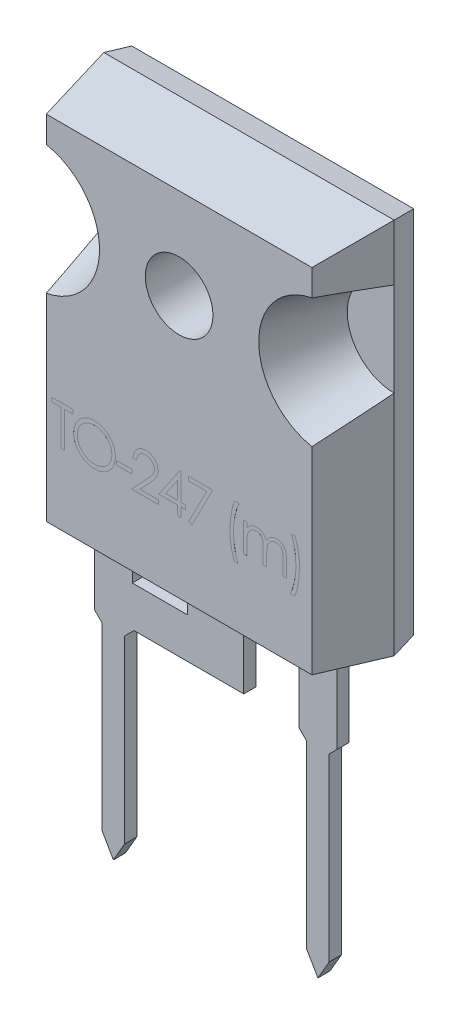
from build123d import *

# Parameters (mm, degrees)
SKETCH1_W                     = 15.5
SKETCH1_H                     = 20.15
BOSS_EXTRUDE1_DEPTH           = 1.27
BOSS_EXTRUDE1_TAPER           = 10
BOSS_EXTRUDE1_OTHER_WAY_DEPTH = 3.73
BOSS_EXTRUDE1_OTHER_WAY_TAPER = 10
SKETCH2_R                     = 2.5
CUT_EXTRUDE1_DEPTH            = 3.73
CUT_EXTRUDE1_DRAFT            = -15
CUT_EXTRUDE1_PROFILE_2_DEPTH  = 3.73
CUT_EXTRUDE1_PROFILE_2_DRAFT  = -15
CUT_EXTRUDE2_DEPTH            = 14.246925249
CUT_EXTRUDE2_DEPTH_BACK       = 14.246925249
SKETCH4_R                     = 1.805
SKETCH5_W                     = 2.02
SKETCH5_H                     = 0.65
SKETCH5_W_2                   = 3
BOSS_EXTRUDE2_DEPTH           = 14.07
SKETCH6_W                     = 7.97
SKETCH6_H                     = 2.154431013
BOSS_EXTRUDE3_DEPTH           = 0.65
SKETCH7_R                     = 1.805
BOSS_EXTRUDE4_DEPTH           = 0.0001
BOSS_EXTRUDE5_DEPTH           = 0.65
CHAMFER1_SIZE                 = 0.5
SKETCH9_W                     = 0.814102564
SKETCH9_H                     = 0.217094017
CUT_EXTRUDE3_DEPTH            = 0.0001


with BuildPart() as part:
    # Sketch1 → Boss-Extrude1 (new body)
    with BuildSketch(Plane.XY):
        Rectangle(SKETCH1_W, SKETCH1_H)
    extrude(amount=-BOSS_EXTRUDE1_DEPTH, taper=BOSS_EXTRUDE1_TAPER)

    # Sketch1 → Boss-Extrude1 other way (add)
    with BuildSketch(Plane.XY):
        Rectangle(SKETCH1_W, SKETCH1_H)
    extrude(amount=BOSS_EXTRUDE1_OTHER_WAY_DEPTH, taper=BOSS_EXTRUDE1_OTHER_WAY_TAPER)


with BuildPart() as cut_extrude1_tool:
    # Sketch2 → Cut-Extrude1 (with draft: the straight prism first)
    with BuildSketch(Plane.XY):
        with Locations((-7.75, 4.575)):
            Circle(SKETCH2_R)
    extrude(amount=CUT_EXTRUDE1_DEPTH)
    # Cut-Extrude1: the draft: its side faces are tilted about the plane it starts from
    cut_extrude1_sides = [cut_extrude1_tool.faces().sort_by_distance(p)[0] for p in [
        (-10.25, 4.575, 1.865),
    ]]
    draft(cut_extrude1_sides, Plane.XY, CUT_EXTRUDE1_DRAFT)


with BuildPart() as part_1:
    add(part.part)

    # Cut-Extrude1: cut by cut_extrude1_tool
    add(cut_extrude1_tool.part, mode=Mode.SUBTRACT)


with BuildPart() as cut_extrude1_profile_2_tool:
    # Sketch2 → Cut-Extrude1 profile 2 (with draft: the straight prism first)
    with BuildSketch(Plane.XY):
        with Locations((7.75, 4.575)):
            Circle(SKETCH2_R)
    extrude(amount=CUT_EXTRUDE1_PROFILE_2_DEPTH)
    # Cut-Extrude1 profile 2: the draft: its side faces are tilted about the plane it starts from
    cut_extrude1_profile_2_sides = [cut_extrude1_profile_2_tool.faces().sort_by_distance(p)[0] for p in [
        (5.25, 4.575, 1.865),
    ]]
    draft(cut_extrude1_profile_2_sides, Plane.XY, CUT_EXTRUDE1_PROFILE_2_DRAFT)


with BuildPart() as part_2:
    add(part_1.part)

    # Cut-Extrude1 profile 2: cut by cut_extrude1_profile_2_tool
    add(cut_extrude1_profile_2_tool.part, mode=Mode.SUBTRACT)

    # Sketch4 → Cut-Extrude2 (cut, two sides: drawn at the far end of the back side and taken through both)
    with BuildSketch(Plane.XY.offset(-CUT_EXTRUDE2_DEPTH_BACK)):
        with Locations(Location((0, 4.565, 0), (0, 0, 180))):
            Circle(SKETCH4_R)
    extrude(amount=CUT_EXTRUDE2_DEPTH + CUT_EXTRUDE2_DEPTH_BACK, mode=Mode.SUBTRACT)

    # Sketch5 → Boss-Extrude2 (add)
    with BuildSketch(Plane(origin=(0, 0, 0), x_dir=(1, 0, 0), z_dir=(0, 1, 0))):
        with Locations((-5.46, -1.455)):
            Rectangle(SKETCH5_W, SKETCH5_H)
        with Locations((5.46, -1.455)):
            Rectangle(SKETCH5_W, SKETCH5_H)
        with Locations((0, -1.455)):
            Rectangle(SKETCH5_W_2, SKETCH5_H)
    extrude(amount=-BOSS_EXTRUDE2_DEPTH)

    # Sketch6 → Boss-Extrude3 (add)
    with BuildSketch(Plane.XY.offset(1.78)):
        with Locations((-2.485, -12.992784494)):
            Rectangle(SKETCH6_W, SKETCH6_H)
    extrude(amount=-BOSS_EXTRUDE3_DEPTH)

    # Sketch7 → Boss-Extrude4 (add)
    with BuildSketch(Plane(origin=(0, 0, -1.27), x_dir=(-1, 0, 0), z_dir=(0, 0, -1))):
        with BuildLine():
            Line((-5.9, 9.225), (5.9, 9.225))
            ThreePointArc((5.9, 9.225), (6.607106781, 8.932106781), (6.9, 8.225))
            Line((6.9, 8.225), (6.9, -3.855))
            Line((6.9, -3.855), (-6.9, -3.855))
            Line((-6.9, -3.855), (-6.9, 8.225))
            ThreePointArc((-6.9, 8.225), (-6.607106781, 8.932106781), (-5.9, 9.225))
        make_face()
        with Locations((0, 4.565)):
            Circle(SKETCH7_R, mode=Mode.SUBTRACT)
    extrude(amount=BOSS_EXTRUDE4_DEPTH)

    # Sketch8 → Boss-Extrude5 (add)
    with BuildSketch(Plane.XY.offset(1.78)):
        Polygon((-6.06, -14.07), (-6.06, -24.185769515), (-5.46, -25.225), (-4.86, -24.185769515), (-4.86, -14.07), align=None)
        Polygon((6.06, -14.07), (6.06, -24.185769515), (5.46, -25.225), (4.86, -24.185769515), (4.86, -14.07), align=None)
    extrude(amount=-BOSS_EXTRUDE5_DEPTH)

    # Chamfer1
    # the kernel refuses this chamfer: 0.5 mm, written as the material it adds along each edge
    with BuildSketch(Plane(origin=(4.86, -14.07, 1.78), x_dir=(-0.9996219169112968, 0.027495876610585647, 0), z_dir=(0, 0, -1))) as chamfer1_piece_1_section:
        Polygon((CHAMFER1_SIZE * 0.999621916911, -CHAMFER1_SIZE * 0.0274958766106), (-CHAMFER1_SIZE * 0.0274958766106, -CHAMFER1_SIZE * 0.999621916911), (0, 0), align=None)
    chamfer1_piece_1 = extrude(amount=0.65, mode=Mode.PRIVATE)
    chamfer1_piece_1 = split(chamfer1_piece_1, bisect_by=Plane(origin=(4.45, -14.241727984, 1.455), z_dir=(1, 0, 0)), keep=Keep.TOP, mode=Mode.PRIVATE)
    add(chamfer1_piece_1)
    with BuildSketch(Plane(origin=(6.06, -14.07, 1.78), x_dir=(0.9996219169112968, 0.027495876610585647, 0), z_dir=(0, 0, -1))) as chamfer1_piece_2_section:
        Polygon((CHAMFER1_SIZE * 0.999621916911, CHAMFER1_SIZE * 0.0274958766106), (-CHAMFER1_SIZE * 0.0274958766106, CHAMFER1_SIZE * 0.999621916911), (0, 0), align=None)
    chamfer1_piece_2 = extrude(amount=0.65, mode=Mode.PRIVATE)
    chamfer1_piece_2 = split(chamfer1_piece_2, bisect_by=Plane(origin=(6.47, -14.241727984, 1.455), z_dir=(-1, 0, 0)), keep=Keep.TOP, mode=Mode.PRIVATE)
    add(chamfer1_piece_2)
    with BuildSketch(Plane(origin=(-4.86, -14.07, 1.78), x_dir=(0.9996219169112968, 0.027495876610585647, 0), z_dir=(0, 0, -1))) as chamfer1_piece_3:
        Polygon((CHAMFER1_SIZE * 0.999621916911, CHAMFER1_SIZE * 0.0274958766106), (-CHAMFER1_SIZE * 0.0274958766106, CHAMFER1_SIZE * 0.999621916911), (0, 0), align=None)
    extrude(amount=0.65)
    with BuildSketch(Plane(origin=(-6.06, -14.07, 1.78), x_dir=(-0.9996219169112968, 0.027495876610585647, 0), z_dir=(0, 0, -1))) as chamfer1_piece_4_section:
        Polygon((CHAMFER1_SIZE * 0.999621916911, -CHAMFER1_SIZE * 0.0274958766106), (-CHAMFER1_SIZE * 0.0274958766106, -CHAMFER1_SIZE * 0.999621916911), (0, 0), align=None)
    chamfer1_piece_4 = extrude(amount=0.65, mode=Mode.PRIVATE)
    chamfer1_piece_4 = split(chamfer1_piece_4, bisect_by=Plane(origin=(-6.47, -14.241727984, 1.455), z_dir=(1, 0, 0)), keep=Keep.TOP, mode=Mode.PRIVATE)
    add(chamfer1_piece_4)

    # Sketch9 → Cut-Extrude3 (cut)
    # profile 1 of 9: a face of its own
    with BuildSketch(Plane.XY.offset(3.73)):
        Polygon((-6.778760684, -3.741015158), (-6.778760684, -3.523921141), (-5.666153846, -3.523921141), (-5.666153846, -3.741015158), (-6.127478632, -3.741015158), (-6.127478632, -5.640587807), (-6.317435897, -5.640587807), (-6.317435897, -3.741015158), align=None)
    # profile 2 of 9: a face of its own
    with BuildSketch(Plane.XY.offset(3.73)):
        with BuildLine():
            add(Edge.make_bspline(
                [(-4.529123932, -3.469647636), (-4.489930458, -3.47064034), (-4.412951242, -3.472590093), (-4.299815471, -3.487515075), (-4.191807961, -3.51333562), (-4.088048877, -3.547724186), (-3.989779315, -3.593598029), (-3.896259604, -3.649045714), (-3.807712256, -3.714648143), (-3.725330754, -3.7898982), (-3.649942979, -3.871772955), (-3.583524467, -3.959147691), (-3.527860794, -4.05149411), (-3.48214939, -4.148534707), (-3.44628785, -4.250050021), (-3.421541571, -4.356581251), (-3.405734213, -4.467438154), (-3.403886195, -4.543049639), (-3.402948718, -4.58140645)],
                knots=[0, 0, 0, 0, 1.065120563, 2.091984664, 3.0946048, 4.079830382, 5.057816894, 6.036188127, 7.030412546, 8.04752943, 9.064399622, 10.05169764, 11.02544977, 11.989514704, 12.962713494, 13.945757189, 14.957906945, 16, 16, 16, 16], degree=3))
            add(Edge.make_bspline(
                [(-3.402948718, -4.58140645), (-3.403886058, -4.619480716), (-3.405733664, -4.694529503), (-3.421559544, -4.804682919), (-3.446379577, -4.910571102), (-3.481816367, -5.012017283), (-3.52730987, -5.109128476), (-3.583344188, -5.201649158), (-3.649348635, -5.289609659), (-3.724464206, -5.372046366), (-3.806349599, -5.447640075), (-3.894179331, -5.513510062), (-3.985978149, -5.570190842), (-4.082927353, -5.615417159), (-4.183741185, -5.651564939), (-4.289321923, -5.676210577), (-4.399174839, -5.69210798), (-4.474087303, -5.693933463), (-4.512163462, -5.694861311)],
                knots=[0, 0, 0, 0, 1.043624062, 2.057103931, 3.04512605, 4.022047818, 4.998200453, 5.980619268, 6.982898556, 8.009068085, 9.034988726, 10.034168286, 11.015286542, 11.987931943, 12.962482838, 13.94673481, 14.956375938, 16, 16, 16, 16], degree=3))
            add(Edge.make_bspline(
                [(-4.512163462, -5.694861311), (-4.550520073, -5.693924301), (-4.626131166, -5.692077205), (-4.737127373, -5.676243689), (-4.843733437, -5.651483948), (-4.945644497, -5.61609967), (-5.042917383, -5.570369249), (-5.135742338, -5.514607553), (-5.223746775, -5.448442282), (-5.306201069, -5.373351068), (-5.381644632, -5.291604463), (-5.447418159, -5.204014223), (-5.503192394, -5.11229878), (-5.548769267, -5.016203611), (-5.584852059, -4.916193262), (-5.609468782, -4.811600611), (-5.625395763, -4.703021958), (-5.627231122, -4.62909411), (-5.628162393, -4.591582732)],
                knots=[0, 0, 0, 0, 1.053102029, 2.075944431, 3.073151272, 4.055350789, 5.033113405, 6.020478099, 7.024410459, 8.052272461, 9.079885166, 10.07527673, 11.055994387, 12.023226415, 12.992069828, 13.970394897, 14.97016774, 16, 16, 16, 16], degree=3))
            add(Edge.make_bspline(
                [(-5.628162393, -4.591582732), (-5.627839066, -4.56640488), (-5.627196491, -4.516366805), (-5.619460562, -4.442061766), (-5.608235152, -4.368951702), (-5.592147329, -4.297244509), (-5.571106654, -4.227115723), (-5.546279952, -4.158081691), (-5.515957284, -4.09084201), (-5.481678987, -4.025078149), (-5.443420655, -3.961815273), (-5.401162464, -3.902016668), (-5.356388694, -3.845180541), (-5.307304165, -3.792779734), (-5.255526601, -3.743289856), (-5.200216058, -3.697471451), (-5.141710034, -3.654911362), (-5.079756785, -3.616557156), (-5.015882876, -3.581868536), (-4.950038348, -3.552101036), (-4.883117469, -3.526552227), (-4.814806801, -3.505844681), (-4.745287744, -3.489496735), (-4.67440857, -3.478364669), (-4.602225745, -3.47060901), (-4.553596043, -3.469969473), (-4.529123932, -3.469647636)],
                knots=[0, 0, 0, 0, 1.037015668, 2.060948919, 3.074880161, 4.083647147, 5.086022904, 6.090072063, 7.104153813, 8.122640571, 9.144368836, 10.147691507, 11.138137339, 12.123020368, 13.103399296, 14.087645067, 15.080126199, 16.082011238, 17.087798457, 18.072939717, 19.057185487, 20.037253025, 21.01195951, 21.997135196, 22.992090687, 24, 24, 24, 24], degree=3))
        make_face()
        with BuildLine():
            add(Edge.make_bspline(
                [(-4.519795673, -3.686741653), (-4.539882618, -3.686986516), (-4.579864476, -3.687473899), (-4.639303219, -3.693893879), (-4.697960246, -3.70304386), (-4.755847669, -3.716095541), (-4.812723283, -3.733877992), (-4.869117234, -3.754343685), (-4.924515271, -3.77927263), (-4.978734509, -3.807438027), (-5.031297436, -3.838612851), (-5.080895593, -3.873067205), (-5.127657383, -3.909993093), (-5.171468311, -3.94947669), (-5.212199734, -3.991719068), (-5.250653339, -4.036079827), (-5.2852878, -4.083826923), (-5.317029078, -4.133665597), (-5.345433438, -4.185530935), (-5.370691534, -4.238876899), (-5.391352625, -4.294138643), (-5.408202728, -4.350716633), (-5.422172614, -4.408521264), (-5.431022654, -4.467991039), (-5.437513176, -4.528827131), (-5.437972702, -4.569939966), (-5.438205128, -4.590734709)],
                knots=[0, 0, 0, 0, 1.008559885, 2.007477868, 2.99961109, 3.989939068, 4.984837346, 5.991145699, 7.001802488, 8.033829008, 9.059044045, 10.069351652, 11.065060232, 12.050310815, 13.029377138, 14.011219647, 14.996725999, 15.989392538, 16.977580475, 17.965360261, 18.951710183, 19.937753436, 20.929683414, 21.935841486, 22.955955122, 24, 24, 24, 24], degree=3))
            add(Edge.make_bspline(
                [(-5.438205128, -4.590734709), (-5.43743414, -4.621312814), (-5.435917368, -4.681469406), (-5.422638267, -4.769624426), (-5.402184025, -4.854344485), (-5.372032189, -4.935166021), (-5.334324912, -5.012783754), (-5.287741984, -5.086509131), (-5.232551965, -5.156362079), (-5.169860213, -5.221854932), (-5.101326957, -5.281633109), (-5.028554307, -5.334104313), (-4.952321887, -5.378500036), (-4.872430902, -5.414667865), (-4.789307867, -5.443327374), (-4.702417157, -5.462969212), (-4.612337594, -5.475896273), (-4.550935721, -5.477137702), (-4.519795673, -5.477767294)],
                knots=[0, 0, 0, 0, 1.032063989, 2.030389145, 3.003944642, 3.970395727, 4.937377036, 5.913328081, 6.909231446, 7.93887556, 8.970685674, 9.976071282, 10.964166581, 11.944589148, 12.933237628, 13.927779006, 14.949070134, 16, 16, 16, 16], degree=3))
            add(Edge.make_bspline(
                [(-4.519795673, -5.477767294), (-4.498865165, -5.477479727), (-4.457353681, -5.476909396), (-4.395610198, -5.471164958), (-4.334979061, -5.461953304), (-4.275545311, -5.448690479), (-4.217376401, -5.432091454), (-4.160229544, -5.412371542), (-4.104713435, -5.3877691), (-4.050127724, -5.360586291), (-3.997878568, -5.329598196), (-3.948000508, -5.296313219), (-3.901750749, -5.25944172), (-3.857972596, -5.220544757), (-3.817073946, -5.178838049), (-3.77933137, -5.13437582), (-3.744871956, -5.086877423), (-3.713142732, -5.037114344), (-3.684837902, -4.985107086), (-3.660176256, -4.93156771), (-3.639253843, -4.876628048), (-3.622363747, -4.82020886), (-3.609128254, -4.762417299), (-3.600008493, -4.703175985), (-3.593629199, -4.64260343), (-3.593148367, -4.601634527), (-3.592905983, -4.580982439)],
                knots=[0, 0, 0, 0, 1.047197238, 2.076906641, 3.100256066, 4.114471768, 5.12198147, 6.126382909, 7.136867548, 8.15857795, 9.17633901, 10.174870724, 11.156907918, 12.133735059, 13.104061851, 14.077631395, 15.04955518, 16.038496417, 17.029181396, 18.010275684, 18.986308667, 19.968651475, 20.955262928, 21.950658345, 22.966943676, 24, 24, 24, 24], degree=3))
            add(Edge.make_bspline(
                [(-3.592905983, -4.580982439), (-3.593148561, -4.560471634), (-3.593629759, -4.519784674), (-3.600005446, -4.45963456), (-3.609137889, -4.400819522), (-3.622299146, -4.343570461), (-3.63926281, -4.287872781), (-3.66017991, -4.233778796), (-3.684845305, -4.181086982), (-3.713153136, -4.129927574), (-3.744973182, -4.080836185), (-3.77974351, -4.033905202), (-3.818064459, -3.990015973), (-3.85884115, -3.948084991), (-3.903092114, -3.909006553), (-3.950616901, -3.872767696), (-4.000838554, -3.838493858), (-4.054013596, -3.807575066), (-4.108892083, -3.779021697), (-4.165203857, -3.754558471), (-4.222310979, -3.733771523), (-4.280068228, -3.716041739), (-4.338961744, -3.703094978), (-4.398593583, -3.693885634), (-4.458881244, -3.687476134), (-4.499426429, -3.686987257), (-4.519795673, -3.686741653)],
                knots=[0, 0, 0, 0, 1.02996197, 2.043119294, 3.035359645, 4.018872909, 4.991431989, 5.957985074, 6.929999688, 7.912076566, 8.892894881, 9.867085534, 10.843653904, 11.817741046, 12.803660682, 13.806313499, 14.818574707, 15.856120519, 16.894564902, 17.924820532, 18.937903209, 19.946497019, 20.957711757, 21.963978472, 22.977135795, 24, 24, 24, 24], degree=3))
        make_face(mode=Mode.SUBTRACT)
    # profile 3 of 9: a face of its own
    with BuildSketch(Plane.XY.offset(3.73)):
        with Locations((-2.930769231, -4.826485244)):
            Rectangle(SKETCH9_W, SKETCH9_H)
    # profile 4 of 9: a face of its own
    with BuildSketch(Plane.XY.offset(3.73)):
        with BuildLine():
            Line((-2.268632479, -4.175203192), (-2.458589744, -4.175203192))
            add(Edge.make_bspline(
                [(-2.458589744, -4.175203192), (-2.457351703, -4.150002226), (-2.454920226, -4.100508201), (-2.443533593, -4.028345648), (-2.427240777, -3.959369651), (-2.404204517, -3.894134036), (-2.375595482, -3.832061995), (-2.341287323, -3.773400081), (-2.300651042, -3.718372077), (-2.254564112, -3.667488109), (-2.204508792, -3.620808007), (-2.150499962, -3.580497455), (-2.093746065, -3.546438673), (-2.034419286, -3.517965732), (-1.971850278, -3.496593539), (-1.906606835, -3.480735691), (-1.83840231, -3.471194758), (-1.791932392, -3.470169211), (-1.768298611, -3.469647636)],
                knots=[0, 0, 0, 0, 1.10065271, 2.161652631, 3.183658789, 4.190468796, 5.17591951, 6.163126047, 7.15150782, 8.156236427, 9.156009102, 10.134482811, 11.092018607, 12.041330605, 13.001268258, 13.972401359, 14.968799086, 16, 16, 16, 16], degree=3))
            add(Edge.make_bspline(
                [(-1.768298611, -3.469647636), (-1.745089014, -3.470190988), (-1.699482985, -3.471258656), (-1.632921671, -3.480427469), (-1.569556355, -3.494787898), (-1.509510896, -3.514935793), (-1.453264371, -3.542019709), (-1.400394244, -3.574554411), (-1.350271087, -3.612182594), (-1.305151747, -3.65648371), (-1.26372067, -3.703777533), (-1.227977878, -3.754267837), (-1.197368965, -3.806416024), (-1.171855463, -3.860619746), (-1.153073893, -3.917389368), (-1.138814691, -3.97589839), (-1.130754779, -4.036752443), (-1.129517785, -4.077940693), (-1.128888889, -4.098881076)],
                knots=[0, 0, 0, 0, 1.111607364, 2.184268762, 3.212621178, 4.221274766, 5.211760367, 6.196651075, 7.1921475, 8.207485113, 9.220403448, 10.201281604, 11.166441695, 12.114753415, 13.065576456, 14.026450734, 14.996634279, 16, 16, 16, 16], degree=3))
            add(Edge.make_bspline(
                [(-1.128888889, -4.098881076), (-1.12991291, -4.12836191), (-1.131942981, -4.186806229), (-1.149308342, -4.272691408), (-1.176429804, -4.355902667), (-1.209085348, -4.422872368), (-1.242028207, -4.476837386), (-1.271714462, -4.52126846), (-1.30646699, -4.569108434), (-1.346791606, -4.620197109), (-1.391854152, -4.674934656), (-1.442062794, -4.733288009), (-1.497775567, -4.79465427), (-1.536878565, -4.836567657), (-1.557140759, -4.858286124)],
                knots=[0, 0, 0, 0, 1.184426356, 2.348067706, 3.509069118, 4.696110526, 5.333549288, 6.050745305, 6.844228056, 7.710549037, 8.667450064, 9.695053472, 10.805634456, 12, 12, 12, 12], degree=3))
            Line((-1.557140759, -4.858286124), (-2.086731437, -5.42349379))
            Line((-2.086731437, -5.42349379), (-1.101752137, -5.42349379))
            Line((-1.101752137, -5.42349379), (-1.101752137, -5.640587807))
            Line((-1.101752137, -5.640587807), (-2.54, -5.640587807))
            Line((-2.54, -5.640587807), (-1.719113248, -4.764579527))
            add(Edge.make_bspline(
                [(-1.719113248, -4.764579527), (-1.699127145, -4.743716266), (-1.660737931, -4.70364221), (-1.606440849, -4.645135753), (-1.557673461, -4.59085865), (-1.514120085, -4.540913452), (-1.476725537, -4.494569599), (-1.443540901, -4.45332804), (-1.416952187, -4.415376539), (-1.388095733, -4.371385787), (-1.360147278, -4.317675481), (-1.336130758, -4.25203844), (-1.32148654, -4.184470054), (-1.319729806, -4.138809298), (-1.318846154, -4.115841546)],
                knots=[0, 0, 0, 0, 1.329631726, 2.553950428, 3.673215718, 4.687767853, 5.603093632, 6.413772471, 7.123043292, 7.734684054, 8.834405432, 9.900288307, 10.943827018, 12, 12, 12, 12], degree=3))
            add(Edge.make_bspline(
                [(-1.318846154, -4.115841546), (-1.319230627, -4.101398987), (-1.319988348, -4.072935474), (-1.326675623, -4.03120342), (-1.3367815, -3.990947556), (-1.35126268, -3.952044058), (-1.370377232, -3.914884068), (-1.393644467, -3.879422354), (-1.420489886, -3.845139028), (-1.451545178, -3.812993938), (-1.485660716, -3.783553399), (-1.521701048, -3.757473595), (-1.559831349, -3.735678514), (-1.599890851, -3.717811732), (-1.641767873, -3.703796145), (-1.68554341, -3.694084528), (-1.731096505, -3.687987025), (-1.762201524, -3.687162026), (-1.778050881, -3.686741653)],
                knots=[0, 0, 0, 0, 0.991446411, 1.95395049, 2.89581595, 3.838931463, 4.798493298, 5.75982156, 6.748411868, 7.785213223, 8.824556874, 9.840280684, 10.836137867, 11.835679398, 12.848801643, 13.863922112, 14.911575587, 16, 16, 16, 16], degree=3))
            add(Edge.make_bspline(
                [(-1.778050881, -3.686741653), (-1.794603718, -3.687174078), (-1.827110757, -3.688023287), (-1.874837982, -3.69396366), (-1.920367952, -3.704211859), (-1.963815198, -3.718228229), (-2.005253233, -3.736043637), (-2.044480536, -3.758233406), (-2.081409045, -3.784711995), (-2.116108181, -3.814732713), (-2.148078301, -3.848156452), (-2.176167603, -3.885415811), (-2.200711268, -3.925830486), (-2.222125424, -3.969291428), (-2.23951577, -4.016193), (-2.252804294, -4.066368707), (-2.263319197, -4.119600686), (-2.266831969, -4.156361189), (-2.268632479, -4.175203192)],
                knots=[0, 0, 0, 0, 1.031018746, 2.02475058, 2.990194455, 3.934040569, 4.864654155, 5.795059489, 6.735614925, 7.690564532, 8.649604399, 9.611025574, 10.590972636, 11.591080095, 12.624614302, 13.701020113, 14.821632451, 16, 16, 16, 16], degree=3))
        make_face()
    # profile 5 of 9: a face of its own
    with BuildSketch(Plane.XY.offset(3.73)):
        Polygon((0.064534589, -3.469647636), (0.103119658, -3.469647636), (0.103119658, -4.935032252), (0.347350427, -4.935032252), (0.347350427, -5.152126269), (0.103119658, -5.152126269), (0.103119658, -5.640587807), (-0.086837607, -5.640587807), (-0.086837607, -5.152126269), (-1.090897436, -5.152126269), align=None)
        Polygon((-0.086837607, -4.935032252), (-0.086837607, -4.015774773), (-0.717767094, -4.935032252), align=None, mode=Mode.SUBTRACT)
    # profile 6 of 9: a face of its own
    with BuildSketch(Plane.XY.offset(3.73)):
        Polygon((0.493888889, -3.523921141), (1.796452991, -3.523921141), (0.683846154, -5.694861311), (0.519753606, -5.604546808), (1.475052083, -3.741015158), (0.493888889, -3.741015158), align=None)
    # profile 7 of 9: a face of its own
    with BuildSketch(Plane.XY.offset(3.73)):
        with BuildLine():
            Line((2.957905983, -3.442510884), (3.202136752, -3.442510884))
            add(Edge.make_bspline(
                [(3.202136752, -3.442510884), (3.190919219, -3.466736448), (3.16814216, -3.515926149), (3.137189507, -3.592194004), (3.107177227, -3.671072361), (3.079993058, -3.753356488), (3.052942358, -3.838234059), (3.028663655, -3.926458343), (3.005599402, -4.017464274), (2.977400292, -4.142960817), (2.947598382, -4.30328488), (2.922254359, -4.499031695), (2.906535963, -4.697750179), (2.904603558, -4.831403379), (2.903632479, -4.898567241)],
                knots=[0, 0, 0, 0, 0.641680859, 1.302924882, 1.97816193, 2.670100703, 3.385789831, 4.119463781, 4.869353995, 5.64252846, 7.211246119, 8.787408069, 10.385597356, 12, 12, 12, 12], degree=3))
            add(Edge.make_bspline(
                [(2.903632479, -4.898567241), (2.904517036, -4.960631317), (2.906273646, -5.083882115), (2.918198548, -5.267003442), (2.938641218, -5.446817531), (2.966815242, -5.621978542), (3.001984027, -5.790289614), (3.044135861, -5.949131964), (3.091234272, -6.097976638), (3.129320938, -6.191879969), (3.147863248, -6.237596354)],
                knots=[0, 0, 0, 0, 1.087438645, 2.159504985, 3.213761363, 4.257235816, 5.266994431, 6.225081839, 7.135889631, 8, 8, 8, 8], degree=3))
            Line((3.147863248, -6.237596354), (2.957905983, -6.237596354))
            add(Edge.make_bspline(
                [(2.957905983, -6.237596354), (2.948733997, -6.216023842), (2.930143731, -6.172299538), (2.904218073, -6.104768129), (2.880166464, -6.034253442), (2.857331744, -5.960994342), (2.83568743, -5.884936094), (2.815294091, -5.806227676), (2.79676151, -5.724588968), (2.77336602, -5.611824838), (2.749508399, -5.46690136), (2.728709372, -5.289632812), (2.716188693, -5.108775685), (2.714517652, -4.987063784), (2.713675214, -4.925703993)],
                knots=[0, 0, 0, 0, 0.628236805, 1.273343465, 1.938200331, 2.624718736, 3.329767296, 4.057431036, 4.803593529, 5.573251756, 7.143838059, 8.738091941, 10.355542947, 12, 12, 12, 12], degree=3))
            add(Edge.make_bspline(
                [(2.713675214, -4.925703993), (2.71436767, -4.85939878), (2.71574632, -4.727388001), (2.72807597, -4.530914473), (2.747529435, -4.336991991), (2.774415347, -4.146541948), (2.809040952, -3.960771689), (2.850967328, -3.781352871), (2.899785414, -3.608741108), (2.938695967, -3.497453314), (2.957905983, -3.442510884)],
                knots=[0, 0, 0, 0, 1.053308321, 2.097090816, 3.12621109, 4.149053282, 5.151853223, 6.127344058, 7.075475725, 8, 8, 8, 8], degree=3))
        make_face()
    # profile 8 of 9: a face of its own
    with BuildSketch(Plane.XY.offset(3.73)):
        with BuildLine():
            Line((3.43008547, -4.093792935), (3.620042735, -4.093792935))
            Line((3.620042735, -4.093792935), (3.620042735, -4.362616386))
            add(Edge.make_bspline(
                [(3.620042735, -4.362616386), (3.63714779, -4.339098646), (3.669922717, -4.294036401), (3.723665278, -4.234654658), (3.777353689, -4.184260965), (3.816018162, -4.157806942), (3.834592682, -4.145098357)],
                knots=[0, 0, 0, 0, 1.134379233, 2.173579362, 3.122582517, 4, 4, 4, 4], degree=3))
            add(Edge.make_bspline(
                [(3.834592682, -4.145098357), (3.859910834, -4.132999875), (3.910104802, -4.109014284), (3.989582143, -4.08468256), (4.0709073, -4.069729761), (4.125824649, -4.067684835), (4.153449519, -4.066656183)],
                knots=[0, 0, 0, 0, 1.014936303, 2.012140481, 3.000054389, 4, 4, 4, 4], degree=3))
            add(Edge.make_bspline(
                [(4.153449519, -4.066656183), (4.172132427, -4.067288335), (4.209104896, -4.06853933), (4.263886703, -4.076679447), (4.317020244, -4.090749942), (4.368191586, -4.110348657), (4.416403616, -4.134083558), (4.460605178, -4.161932667), (4.500292199, -4.193197089), (4.535444621, -4.229288634), (4.567054936, -4.271220767), (4.596131191, -4.320124385), (4.622997867, -4.377097589), (4.637887897, -4.418443069), (4.645727163, -4.440210537)],
                knots=[0, 0, 0, 0, 1.009824226, 1.998387844, 2.986035974, 3.974953746, 4.955485308, 5.885931332, 6.793869504, 7.679848016, 8.601185859, 9.625726857, 10.749998409, 12, 12, 12, 12], degree=3))
            add(Edge.make_bspline(
                [(4.645727163, -4.440210537), (4.654019206, -4.42525815), (4.670336781, -4.395833952), (4.697735904, -4.354191099), (4.726442619, -4.315240324), (4.756701575, -4.278950725), (4.788405968, -4.245501507), (4.821705005, -4.214782081), (4.856409135, -4.186660523), (4.904664442, -4.153807946), (4.967446352, -4.118912469), (5.046602498, -4.088657172), (5.128940935, -4.069960275), (5.184831638, -4.067764825), (5.213054888, -4.066656183)],
                knots=[0, 0, 0, 0, 0.86119277, 1.694706429, 2.50939023, 3.298075842, 4.073795165, 4.829715201, 5.57930267, 6.321991688, 7.768977793, 9.186738141, 10.579381044, 12, 12, 12, 12], degree=3))
            add(Edge.make_bspline(
                [(5.213054888, -4.066656183), (5.238987963, -4.067634217), (5.289741509, -4.069548323), (5.363629665, -4.084578757), (5.432537328, -4.110388572), (5.496325846, -4.145606057), (5.553874876, -4.18986204), (5.603898548, -4.242517956), (5.646093006, -4.303201352), (5.673657231, -4.360286031), (5.692353605, -4.410684065), (5.703881114, -4.453625965), (5.71406512, -4.500889047), (5.722520444, -4.552529824), (5.728700235, -4.608730716), (5.733278715, -4.66939975), (5.73637756, -4.73458408), (5.736596527, -4.779557501), (5.736709402, -4.802740585)],
                knots=[0, 0, 0, 0, 1.209669288, 2.367440248, 3.500751976, 4.631527125, 5.755587489, 6.87532382, 8.007944318, 9.190864318, 9.82315674, 10.514484317, 11.263564316, 12.079023757, 12.955305781, 13.901327259, 14.918167583, 16, 16, 16, 16], degree=3))
            Line((5.736709402, -4.802740585), (5.736709402, -5.640587807))
            Line((5.736709402, -5.640587807), (5.546752137, -5.640587807))
            Line((5.546752137, -5.640587807), (5.546752137, -4.801892561))
            add(Edge.make_bspline(
                [(5.546752137, -4.801892561), (5.546705036, -4.782104405), (5.546614516, -4.744074577), (5.54498551, -4.689493333), (5.541916153, -4.639740565), (5.53832711, -4.594884111), (5.533341568, -4.554819368), (5.526903314, -4.51962681), (5.520083003, -4.4890296), (5.508752189, -4.455110895), (5.490640845, -4.417694149), (5.463053131, -4.377342272), (5.4282974, -4.342217217), (5.388165306, -4.311726139), (5.342476484, -4.286934747), (5.292121152, -4.269229731), (5.23741194, -4.258269705), (5.199540063, -4.257177496), (5.179981971, -4.256613448)],
                knots=[0, 0, 0, 0, 1.253487763, 2.409012846, 3.458416907, 4.410876679, 5.259312806, 6.014470957, 6.676830364, 7.243083969, 8.276244668, 9.299465089, 10.325150304, 11.392391894, 12.482080715, 13.603491619, 14.762376348, 16, 16, 16, 16], degree=3))
            add(Edge.make_bspline(
                [(5.179981971, -4.256613448), (5.155991094, -4.257469886), (5.108576, -4.259162533), (5.03936373, -4.276442923), (4.972857448, -4.302496218), (4.91104163, -4.340252989), (4.854177204, -4.385494238), (4.805252221, -4.439287565), (4.764834661, -4.500144711), (4.737466781, -4.556476288), (4.720177061, -4.607076381), (4.708761021, -4.651282887), (4.699881065, -4.701527454), (4.691553174, -4.75747246), (4.686117738, -4.819502998), (4.681177818, -4.887332126), (4.678867106, -4.961163854), (4.678543885, -5.012342851), (4.678376068, -5.038915131)],
                knots=[0, 0, 0, 0, 1.090531906, 2.155305635, 3.229839962, 4.33261226, 5.44038871, 6.529323825, 7.629011124, 8.757537029, 9.370236727, 10.061839251, 10.834451254, 11.692844982, 12.636905849, 13.66920014, 14.789842145, 16, 16, 16, 16], degree=3))
            Line((4.678376068, -5.038915131), (4.678376068, -5.640587807))
            Line((4.678376068, -5.640587807), (4.488418803, -5.640587807))
            Line((4.488418803, -5.640587807), (4.488418803, -4.854046007))
            add(Edge.make_bspline(
                [(4.488418803, -4.854046007), (4.488370767, -4.831855286), (4.488278349, -4.789162568), (4.486659814, -4.727940298), (4.483583619, -4.672253168), (4.480027287, -4.622165902), (4.474910893, -4.577769527), (4.469099275, -4.538826031), (4.462236068, -4.505433043), (4.450872662, -4.468806615), (4.433507245, -4.428456343), (4.405574344, -4.385432963), (4.370735474, -4.34777559), (4.329871182, -4.315627204), (4.283905841, -4.28905307), (4.23311588, -4.269906458), (4.177958623, -4.25876415), (4.139932582, -4.257343868), (4.120376603, -4.256613448)],
                knots=[0, 0, 0, 0, 1.320475261, 2.540461679, 3.643808994, 4.639130445, 5.527981419, 6.302341397, 6.981980563, 7.553956391, 8.582137848, 9.585246428, 10.591171744, 11.620968678, 12.668337649, 13.738356861, 14.836885341, 16, 16, 16, 16], degree=3))
            add(Edge.make_bspline(
                [(4.120376603, -4.256613448), (4.097385846, -4.257539012), (4.051566085, -4.259383628), (3.984254894, -4.275986927), (3.919251647, -4.301994153), (3.857593329, -4.338074139), (3.800942773, -4.382765487), (3.751347297, -4.435328305), (3.709653484, -4.495108434), (3.681996624, -4.550846023), (3.664157071, -4.600178432), (3.652306559, -4.642119243), (3.642122595, -4.68868606), (3.634554591, -4.740022551), (3.627248816, -4.795794356), (3.623722867, -4.856279309), (3.620292923, -4.921425524), (3.620128176, -4.966403206), (3.620042735, -4.989729768)],
                knots=[0, 0, 0, 0, 1.098833095, 2.189935336, 3.297829714, 4.440610912, 5.596351641, 6.740013378, 7.886572111, 9.072425424, 9.705826452, 10.395263256, 11.156850408, 11.985370555, 12.878090359, 13.847760091, 14.883794034, 16, 16, 16, 16], degree=3))
            Line((3.620042735, -4.989729768), (3.620042735, -5.640587807))
            Line((3.620042735, -5.640587807), (3.43008547, -5.640587807))
            Line((3.43008547, -5.640587807), (3.43008547, -4.093792935))
        make_face()
    # profile 9 of 9: a face of its own
    with BuildSketch(Plane.XY.offset(3.73)):
        with BuildLine():
            Line((6.181752137, -6.237596354), (5.937521368, -6.237596354))
            add(Edge.make_bspline(
                [(5.937521368, -6.237596354), (5.948918652, -6.213387953), (5.972034931, -6.164287822), (6.002798262, -6.087819656), (6.033299246, -6.009037587), (6.061171639, -5.92691529), (6.087275705, -5.841886007), (6.112175268, -5.753913812), (6.134192605, -5.662817816), (6.162884298, -5.537480494), (6.192610838, -5.377131979), (6.217235513, -5.181178949), (6.233162481, -4.982361726), (6.235068049, -4.84870542), (6.236025641, -4.781539997)],
                knots=[0, 0, 0, 0, 0.643010096, 1.304170363, 1.980525948, 2.673468857, 3.388058623, 4.118367826, 4.870637152, 5.640399836, 7.208918794, 8.78781499, 10.385801844, 12, 12, 12, 12], degree=3))
            add(Edge.make_bspline(
                [(6.236025641, -4.781539997), (6.23513625, -4.719335603), (6.233374048, -4.596086495), (6.221557698, -4.412792334), (6.200510321, -4.233174482), (6.172462862, -4.05797559), (6.137015319, -3.889775412), (6.095807426, -3.730716704), (6.04829713, -3.582028065), (6.010312224, -3.488234521), (5.991794872, -3.442510884)],
                knots=[0, 0, 0, 0, 1.089953881, 2.159587681, 3.216624426, 4.25769169, 5.267486842, 6.22737404, 7.135858364, 8, 8, 8, 8], degree=3))
            Line((5.991794872, -3.442510884), (6.181752137, -3.442510884))
            add(Edge.make_bspline(
                [(6.181752137, -3.442510884), (6.191101089, -3.464068538), (6.210027605, -3.507710998), (6.235857685, -3.575534809), (6.260175878, -3.646041122), (6.283831392, -3.719278451), (6.305253432, -3.795420098), (6.325119626, -3.874503114), (6.343898845, -3.956306576), (6.366332218, -4.069661383), (6.390772986, -4.214570265), (6.410819372, -4.39206442), (6.423497444, -4.572881736), (6.4251505, -4.694737879), (6.425982906, -4.756099292)],
                knots=[0, 0, 0, 0, 0.628844065, 1.27306534, 1.941820192, 2.624928913, 3.332648663, 4.058377701, 4.807203874, 5.57876041, 7.15092291, 8.738794632, 10.357799901, 12, 12, 12, 12], degree=3))
            add(Edge.make_bspline(
                [(6.425982906, -4.756099292), (6.42530409, -4.822264384), (6.423955502, -4.953712955), (6.411447432, -5.149745271), (6.3923457, -5.343305079), (6.364664945, -5.533668364), (6.330092296, -5.719275071), (6.288812688, -5.898816699), (6.239841367, -6.07135858), (6.200951795, -6.182651429), (6.181752137, -6.237596354)],
                knots=[0, 0, 0, 0, 1.05226665, 2.090512442, 3.123047645, 4.145154173, 5.149102219, 6.125200057, 7.074417238, 8, 8, 8, 8], degree=3))
        make_face()
    extrude(amount=-CUT_EXTRUDE3_DEPTH, mode=Mode.SUBTRACT)


solid = part_2.part
